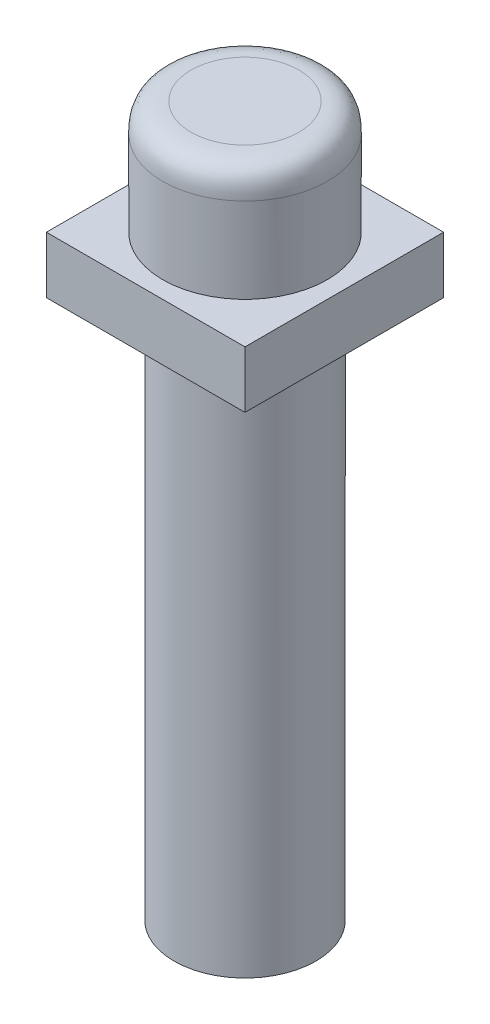
from build123d import *

# Parameters (mm, degrees)
SKETCH8_W           = 7
SKETCH8_H           = 7
BOSS_EXTRUDE3_DEPTH = 2
SKETCH9_R           = 2.9
BOSS_EXTRUDE4_DEPTH = 4
SKETCH10_R          = 2.5
SKETCH10_R_2        = 1.25
BOSS_EXTRUDE5_DEPTH = 19
FILLET1_SIZE        = 1


with BuildPart() as part:
    # Sketch8 → Boss-Extrude3 (new body)
    with BuildSketch(Plane(origin=(0, 0, 0), x_dir=(1, 0, 0), z_dir=(0, 1, 0))):
        Rectangle(SKETCH8_W, SKETCH8_H)
    extrude(amount=BOSS_EXTRUDE3_DEPTH)

    # Sketch9 → Boss-Extrude4 (add)
    with BuildSketch(Plane(origin=(0, 2, 0), x_dir=(1, 0, 0), z_dir=(0, 1, 0))):
        with Locations(Location((0, 0, 0), (0, 0, 270))):
            Circle(SKETCH9_R)
    extrude(amount=BOSS_EXTRUDE4_DEPTH)

    # Sketch10 → Boss-Extrude5 (add)
    with BuildSketch(Plane.XZ):
        with Locations(Location((0, 0, 0), (0, 0, 90))):
            Circle(SKETCH10_R)
        with Locations(Location((0, 0, 0), (0, 0, 270))):
            Circle(SKETCH10_R_2, mode=Mode.SUBTRACT)
    extrude(amount=BOSS_EXTRUDE5_DEPTH)

    # Fillet1
    # a fillet whose section is not a circle: 1 mm, written as the material it takes off along each edge
    with BuildSketch(Plane(origin=(0, 6, 0), x_dir=(0, 0, 1), z_dir=(-1, 0, 0))) as fillet1_piece_1:
        with BuildLine():
            add(Edge.make_bspline([(2.9, -FILLET1_SIZE), (2.9, -FILLET1_SIZE * 0.831801948466), (2.9, -FILLET1_SIZE * 0.663603896932), (2.9 - FILLET1_SIZE * 0.0716919198361, -FILLET1_SIZE * 0.292893218813), (2.9 - FILLET1_SIZE * 0.292893218813, -FILLET1_SIZE * 0.0716919198361), (2.9 - FILLET1_SIZE * 0.663603896932, 0), (2.9 - FILLET1_SIZE * 0.831801948466, 0), (2.9 - FILLET1_SIZE, 0)], knots=[0, 0, 0, 0, 0, 0, 0.5, 0.5, 1, 1, 1, 1, 1, 1], degree=5))
            Line((2.9 - FILLET1_SIZE, 0), (2.9, 0))
            Line((2.9, 0), (2.9, -FILLET1_SIZE))
        make_face()
    revolve(axis=Axis((0, 6, 0), (0, 1, 0)), mode=Mode.SUBTRACT)


solid = part.part
